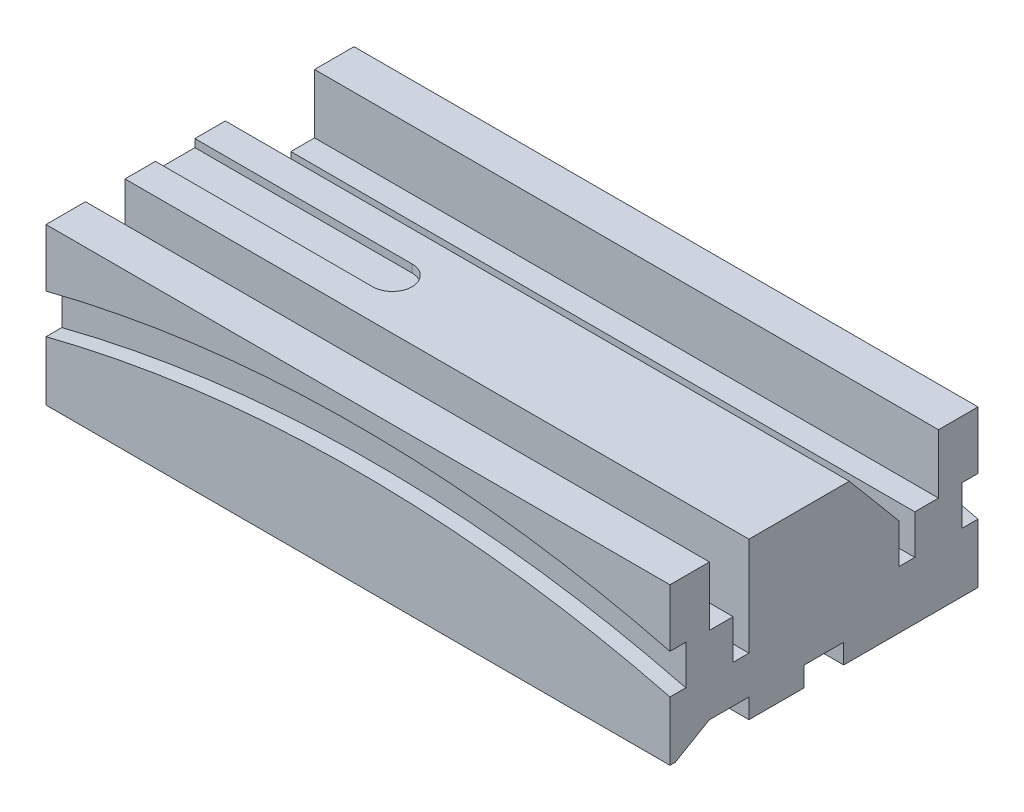
from build123d import *

# Parameters (mm, degrees)
SKETCH1_W           = 200.66
SKETCH1_H           = 99.06
BOSS_EXTRUDE1_DEPTH = 50.292
SKETCH2_W           = 12.7
SKETCH2_H           = 19.05
CUT_EXTRUDE1_DEPTH  = 213.713285349
SKETCH3_W           = 5.08
SKETCH3_H           = 12.7
CUT_EXTRUDE2_DEPTH  = 213.713285349
CUT_EXTRUDE3_DEPTH  = 213.713285349
BOSS_EXTRUDE2_DEPTH = 200.66
SKETCH6_W           = 12.7
SKETCH6_H           = 6.35
CUT_EXTRUDE4_DEPTH  = 213.713285349
CUT_EXTRUDE5_DEPTH  = 213.713285349
CUT_EXTRUDE6_DEPTH  = 5.08
BOSS_EXTRUDE3_DEPTH = 5.08
SKETCH13_W          = 152.4
SKETCH13_H          = 12.7
CUT_EXTRUDE7_DEPTH  = 2.54
FILLET1_R           = 6.35


with BuildPart() as part:
    # Sketch1 → Boss-Extrude1 (new body)
    with BuildSketch(Plane(origin=(0, 0, 0), x_dir=(1, 0, 0), z_dir=(0, 1, 0))):
        Rectangle(SKETCH1_W, SKETCH1_H)
    extrude(amount=-BOSS_EXTRUDE1_DEPTH)

    # Sketch2 → Cut-Extrude1 (cut, through all)
    with BuildSketch(Plane.ZY.offset(100.33)):
        with Locations((-30.48, -9.525)):
            Rectangle(SKETCH2_W, SKETCH2_H)
    cut_extrude1 = extrude(amount=-CUT_EXTRUDE1_DEPTH, mode=Mode.SUBTRACT)

    # Sketch3 → Cut-Extrude2 (cut, through all)
    with BuildSketch(Plane.ZY.offset(100.33)):
        with Locations((-26.67, -25.4)):
            Rectangle(SKETCH3_W, SKETCH3_H)
    cut_extrude2 = extrude(amount=-CUT_EXTRUDE2_DEPTH, mode=Mode.SUBTRACT)

    # Sketch4 → Cut-Extrude3 (cut, through all)
    with BuildSketch(Plane.ZY.offset(100.33)):
        Polygon((-24.13, -19.05), (-8.145152026, 0), (-24.13, 0), align=None)
    cut_extrude3 = extrude(amount=-CUT_EXTRUDE3_DEPTH, mode=Mode.SUBTRACT)

    # Mirror1: Cut-Extrude1, Cut-Extrude2, Cut-Extrude3 across plane
    add(cut_extrude1.mirror(Plane.XY), mode=Mode.SUBTRACT)
    add(cut_extrude2.mirror(Plane.XY), mode=Mode.SUBTRACT)
    add(cut_extrude3.mirror(Plane.XY), mode=Mode.SUBTRACT)

    # Sketch5 → Boss-Extrude2 (add)
    with BuildSketch(Plane(origin=(100.33, 0, 0), x_dir=(0, 0, -1), z_dir=(1, 0, 0))):
        Polygon((-24.13, -19.05), (-8.145152026, 0), (-24.13, 0), align=None)
    extrude(amount=-BOSS_EXTRUDE2_DEPTH)

    # Sketch6 → Cut-Extrude4 (cut, through all)
    with BuildSketch(Plane(origin=(100.33, 0, 0), x_dir=(0, 0, -1), z_dir=(1, 0, 0))):
        with Locations((0, -47.117)):
            Rectangle(SKETCH6_W, SKETCH6_H)
    extrude(amount=-CUT_EXTRUDE4_DEPTH, mode=Mode.SUBTRACT)

    # Sketch7 → Cut-Extrude5 (cut, through all)
    with BuildSketch(Plane.ZY.offset(100.33)):
        Polygon((24.13, -50.292), (24.13, -43.942), (36.83, -43.942), (47.828522628, -50.292), align=None)
    extrude(amount=-CUT_EXTRUDE5_DEPTH, mode=Mode.SUBTRACT)

    # Sketch8 → Cut-Extrude6 (cut)
    with BuildSketch(Plane.XY.offset(49.53)):
        with BuildLine():
            Line((-100.33, -18.542), (-100.33, -31.242))
            ThreePointArc((-100.33, -31.242), (0, -18.662836295), (100.33, -31.242))
            Line((100.33, -31.242), (100.33, -18.542))
            ThreePointArc((100.33, -18.542), (0, -5.962836295), (-100.33, -18.542))
        make_face()
    cut_extrude6 = extrude(amount=-CUT_EXTRUDE6_DEPTH, mode=Mode.SUBTRACT)

    # Mirror2: Cut-Extrude6 across plane
    add(cut_extrude6.mirror(Plane.XY), mode=Mode.SUBTRACT)

    # Sketch9 → Boss-Extrude3 (add)
    with BuildSketch(Plane(origin=(0, 0, -49.53), x_dir=(-1, 0, 0), z_dir=(0, 0, -1))):
        with BuildLine():
            Line((100.33, -18.542), (100.33, -31.242))
            ThreePointArc((100.33, -31.242), (50.5577498, -21.819889754), (0, -18.662836295))
            ThreePointArc((0, -18.662836295), (6.35, -12.312836295), (0, -5.962836295))
            ThreePointArc((0, -5.962836295), (50.5577498, -9.119889754), (100.33, -18.542))
        make_face()
    extrude(amount=-BOSS_EXTRUDE3_DEPTH)

    # Sketch13 → Cut-Extrude7 (cut)
    with BuildSketch(Plane(origin=(0, 0, 0), x_dir=(1, 0, 0), z_dir=(0, 1, 0))):
        with Locations((-100.33, -7.992423987)):
            Rectangle(SKETCH13_W, SKETCH13_H)
    extrude(amount=-CUT_EXTRUDE7_DEPTH, mode=Mode.SUBTRACT)

    # Fillet1
    fillet1_edges = [part.edges().sort_by_distance(p)[0] for p in [
        (-24.13, -1.27, 14.342423987),
        (-24.13, -1.27, 1.642423987),
    ]]
    fillet(fillet1_edges, radius=FILLET1_R - 0.0001)  # a hair under: the kernel refuses the full size


solid = part.part
